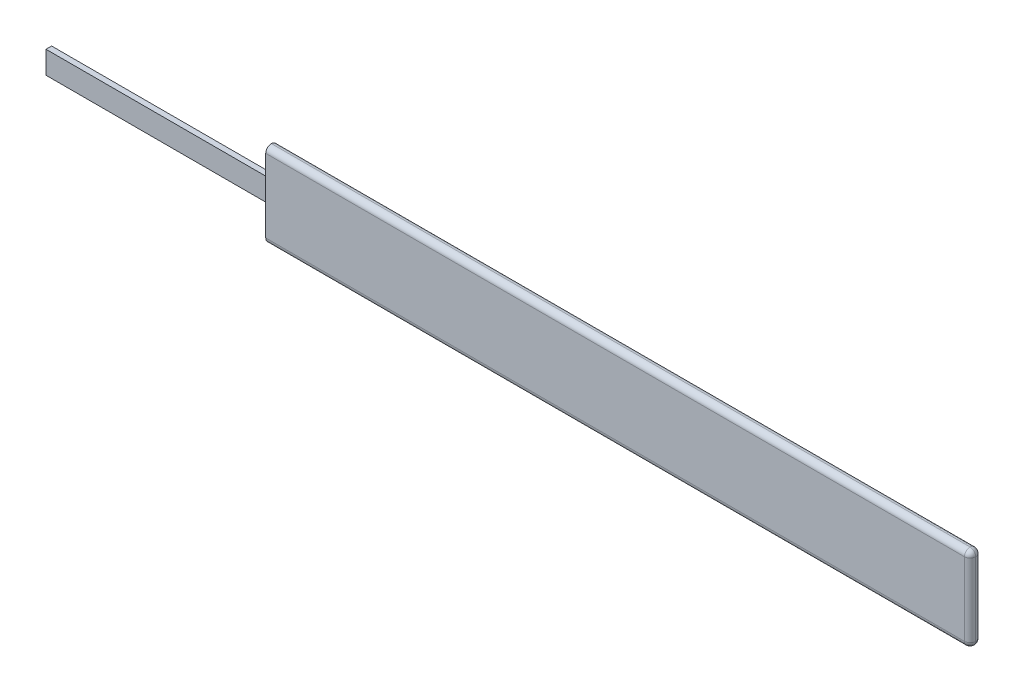
from build123d import *

# Parameters (mm, degrees)
ESQUISSE1_W             = 40
ESQUISSE1_H             = 4
BOSS_EXTRU_2_DEPTH      = 2
ESQUISSE2_W             = 1
ESQUISSE2_H             = 4
ENL_V_MAT_EXTRU_1_DEPTH = 40
CONG_1_R                = 1
CONG_2_R                = 1


with BuildPart() as part:
    # Esquisse1 → Boss.-Extru.2 (new body)
    with BuildSketch(Plane.XY):
        Rectangle(ESQUISSE1_W, ESQUISSE1_H)
        Polygon((145, 7.5), (145, -7.5), (20, -7.5), (20, -2), (20, 2), (20, 7.5), align=None)
    extrude(amount=BOSS_EXTRU_2_DEPTH)

    # Esquisse2 → Enlèv. mat.-Extru.1 (cut)
    with BuildSketch(Plane.ZY.offset(20)):
        with Locations((1.5, 0)):
            Rectangle(ESQUISSE2_W, ESQUISSE2_H)
    extrude(amount=-ENL_V_MAT_EXTRU_1_DEPTH, mode=Mode.SUBTRACT)

    # Congé1
    cong_1_edges = [part.edges().sort_by_distance(p)[0] for p in [
        (82.5, -7.5, 0),
        (82.5, -7.5, 2),
        (82.5, 7.5, 2),
        (82.5, 7.5, 0),
    ]]
    fillet(cong_1_edges, radius=CONG_1_R - 0.0001)  # a hair under: the kernel refuses the full size

    # Congé2
    cong_2_edges = [part.edges().sort_by_distance(p)[0] for p in [
        (145, 0, 0),
        (145, 0, 2),
        (145, 7.207136071, 0.292863929),
        (145, 7.207136071, 1.707136071),
        (145, -7.207136071, 1.707136071),
        (145, -7.207136071, 0.292863929),
    ]]
    fillet(cong_2_edges, radius=CONG_2_R - 0.0001)  # a hair under: the kernel refuses the full size


solid = part.part
